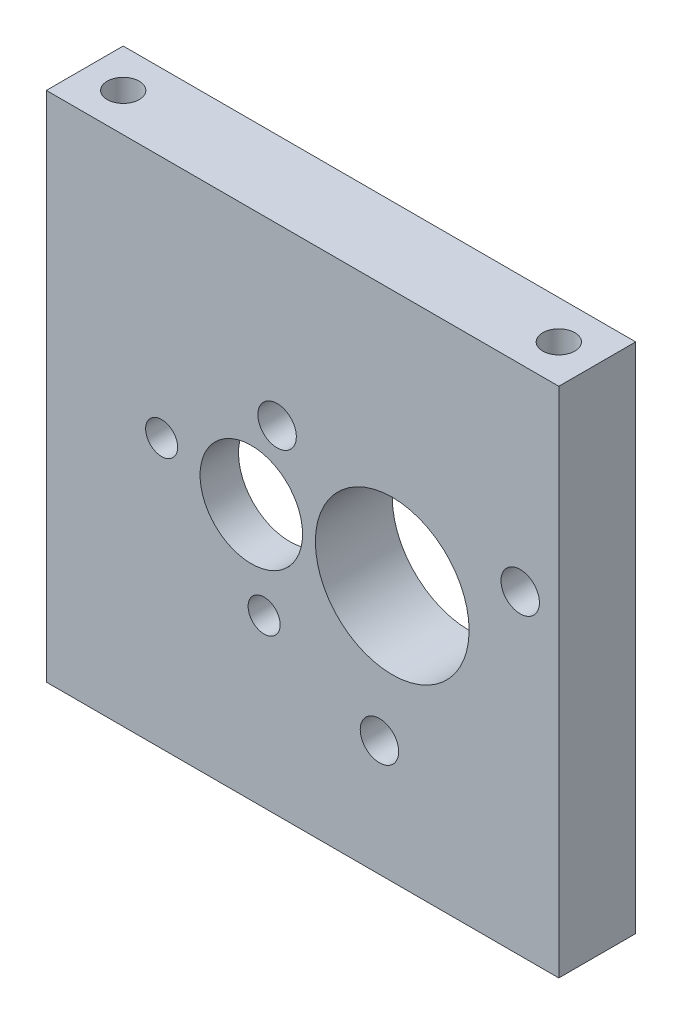
from build123d import *

# Parameters (mm, degrees)
SKETCH1_W           = 40
SKETCH1_H           = 40
EXTRUDE1_DEPTH      = 6
SKETCH8_R           = 6
CUT_EXTRUDE6_DEPTH  = 6
SKETCH5_R           = 1.5
CUT_EXTRUDE4_DEPTH  = 6
CIRPATTERN1_COUNT   = 3
CUT_EXTRUDE13_DEPTH = 3
SKETCH20_R          = 4
CUT_EXTRUDE14_DEPTH = 3
SKETCH25_R          = 1.25
EXTRUDE4_DEPTH      = 3
SKETCH27_R          = 1.25
EXTRUDE9_DEPTH      = 10
EXTRUDE7_START      = -10
SKETCH29_R          = 1.25
EXTRUDE7_DEPTH      = 10


# Read off the part's stored shape, not the designer's step: M3 Tapped Hole1
with BuildPart() as part:
    # Sketch1 → Extrude1 (new body)
    with BuildSketch(Plane.XY):
        with Locations((4, 0)):
            Rectangle(SKETCH1_W, SKETCH1_H)
    extrude(amount=-EXTRUDE1_DEPTH)

    # Sketch8 → Cut-Extrude6 (cut)
    with BuildSketch(Plane(origin=(0, 0, -6), x_dir=(-1, 0, 0), z_dir=(0, 0, -1))):
        with Locations((-11, 0)):
            Circle(SKETCH8_R)
    extrude(amount=-CUT_EXTRUDE6_DEPTH, mode=Mode.SUBTRACT)

    # Sketch5 → Cut-Extrude4 (cut)
    with BuildSketch(Plane(origin=(0, 0, -6), x_dir=(-1, 0, 0), z_dir=(0, 0, -1))):
        with Locations((-10, -10.95445115)):
            Circle(SKETCH5_R)
    cut_extrude4 = extrude(amount=-CUT_EXTRUDE4_DEPTH, mode=Mode.SUBTRACT)

    # CirPattern1: Cut-Extrude4 ×3 about axis
    cirpattern1_axis = Axis((11, 0, 0), (0, 0, 1))
    for i in range(1, CIRPATTERN1_COUNT):
        add(cut_extrude4.rotate(cirpattern1_axis, i * 360 / CIRPATTERN1_COUNT), mode=Mode.SUBTRACT)

    # Sketch19 → Cut-Extrude13 (cut)
    with BuildSketch(Plane(origin=(0, 0, -6), x_dir=(-1, 0, 0), z_dir=(0, 0, -1))):
        with BuildLine():
            Line((10, 4), (0, 4))
            ThreePointArc((0, 4), (-2.828427125, 2.828427125), (-4, 0))
            Line((-4, 0), (-4, -10))
            Line((-4, -10), (0, -10))
            ThreePointArc((0, -10), (7.071067812, -7.071067812), (10, 0))
            Line((10, 0), (10, 4))
        make_face()
    extrude(amount=-CUT_EXTRUDE13_DEPTH, mode=Mode.SUBTRACT)

    # Sketch20 → Cut-Extrude14 (cut)
    with BuildSketch(Plane(origin=(0, 0, -3), x_dir=(-1, 0, 0), z_dir=(0, 0, -1))):
        with Locations(Location((0, 0, 0), (0, 0, 180))):
            Circle(SKETCH20_R)
    extrude(amount=-CUT_EXTRUDE14_DEPTH, mode=Mode.SUBTRACT)

    # Sketch25 → Extrude4 (cut)
    with BuildSketch(Plane(origin=(0, 0, -3), x_dir=(-1, 0, 0), z_dir=(0, 0, -1))):
        with Locations((-1, -7)):
            Circle(SKETCH25_R)
        with Locations((7, 1)):
            Circle(SKETCH25_R)
    extrude(amount=-EXTRUDE4_DEPTH, mode=Mode.SUBTRACT)

    # Sketch27 → Extrude9 (cut)
    with BuildSketch(Plane(origin=(0, 20, 0), x_dir=(1, 0, 0), z_dir=(0, 1, 0))):
        with Locations(Location((-13, 3, 0), (0, 0, 180))):
            Circle(SKETCH27_R)
        with Locations(Location((21, 3, 0), (0, 0, 180))):
            Circle(SKETCH27_R)
    extrude(amount=-EXTRUDE9_DEPTH, mode=Mode.SUBTRACT)

    # Sketch29 → Extrude7 (cut)
    with BuildSketch(Plane.XZ.offset(20).offset(EXTRUDE7_START)):
        with Locations(Location((-13, -3, 0), (0, 0, 180))):
            Circle(SKETCH29_R)
        with Locations(Location((21, -3, 0), (0, 0, 180))):
            Circle(SKETCH29_R)
    extrude(amount=EXTRUDE7_DEPTH, mode=Mode.SUBTRACT)

    # M3 Tapped Hole1 outline → M3 Tapped Hole1 (revolve, cut)
    with BuildSketch(Plane(origin=(-13, 0, -3), x_dir=(1, 0, 0), z_dir=(0, 0, 1))):
        Polygon((1.25, -10), (0, -9.248924226), (0, -10), align=None)
        Polygon((0, 10), (0, 9.248924226), (1.25, 10), align=None)
    revolve(axis=Axis((-13, 0, -3), (0, 1, 0)), mode=Mode.SUBTRACT)

    # M3 Tapped Hole1 2 outline → M3 Tapped Hole1 2 (revolve, cut)
    with BuildSketch(Plane(origin=(21, 0, -3), x_dir=(1, 0, 0), z_dir=(0, 0, 1))):
        Polygon((1.25, -10), (0, -9.248924226), (0, -10), align=None)
        Polygon((0, 10), (0, 9.248924226), (1.25, 10), align=None)
    revolve(axis=Axis((21, 0, -3), (0, 1, 0)), mode=Mode.SUBTRACT)


solid = part.part
